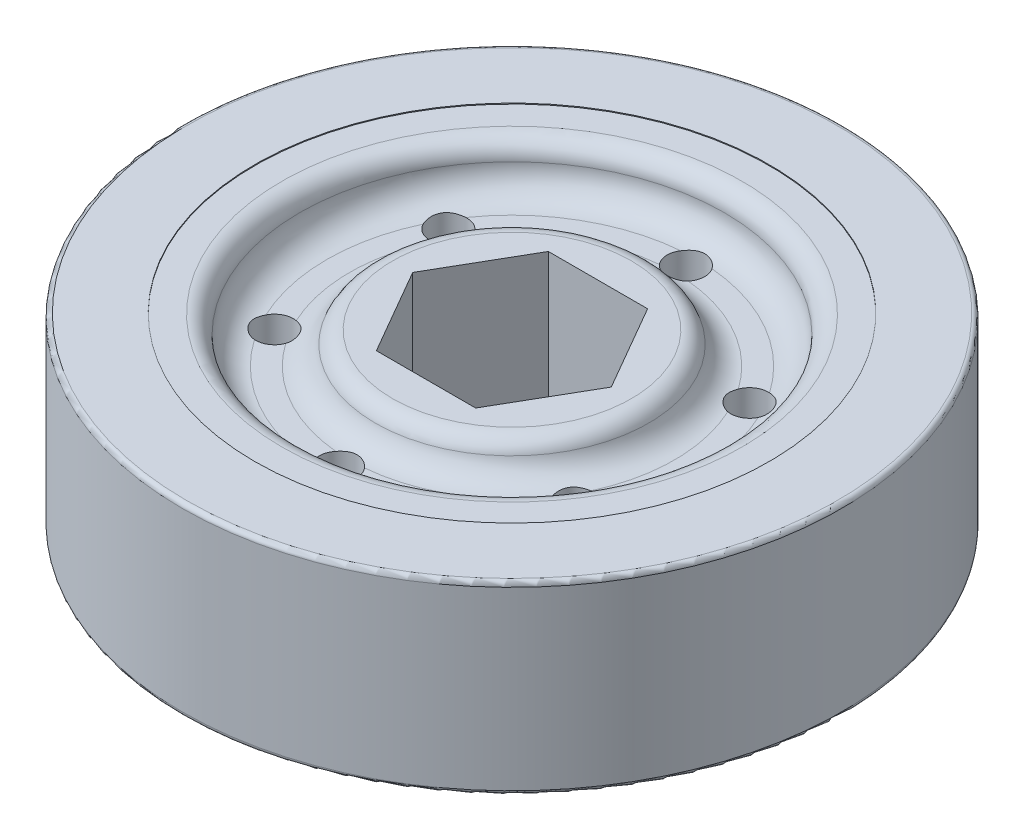
from build123d import *

# Parameters (mm, degrees)
BOSS_EXTRUDE1_DEPTH      = 10.16
BOSS_EXTRUDE1_DEPTH_BACK = 10.16
SKETCH1_R                = 28.5
SKETCH1_R_2              = 23.5
BOSS_EXTRUDE2_DEPTH      = 5.16
BOSS_EXTRUDE2_DEPTH_BACK = 5.16
SKETCH1_3_R              = 23.5
SKETCH1_3_R_2            = 15
BOSS_EXTRUDE3_DEPTH      = 8.66
BOSS_EXTRUDE3_DEPTH_BACK = 8.66
SKETCH1_4_R              = 15
BOSS_EXTRUDE4_DEPTH      = 10.26
BOSS_EXTRUDE4_DEPTH_BACK = 10.26
SKETCH1_5_R              = 36.5125
SKETCH1_5_R_2            = 28.5
FILLET1_R                = 3
FILLET2_R                = 2
FILLET3_R                = 3
FILLET4_R                = 2
FILLET5_R                = 0.5
CUT_EXTRUDE1_DEPTH       = 10.16
CUT_EXTRUDE1_DEPTH_BACK  = 54.889718059
SKETCH2_R                = 2.0828


with BuildPart() as part:
    # Sketch1 → Boss-Extrude1 (new, two sides: drawn at the far end of the back side and taken through both)
    with BuildSketch(Plane(origin=(0, 0, 0), x_dir=(1, 0, 0), z_dir=(0, 1, 0)).offset(-BOSS_EXTRUDE1_DEPTH_BACK)):
        with Locations(Location((0, 0, 0), (0, 0, 270))):
            Circle(SKETCH1_R)
        with Locations(Location((0, 0, 0), (0, 0, 270))):
            Circle(SKETCH1_R_2, mode=Mode.SUBTRACT)
    extrude(amount=BOSS_EXTRUDE1_DEPTH + BOSS_EXTRUDE1_DEPTH_BACK)

    # Sketch1<3> → Boss-Extrude2 (add, two sides: drawn at the far end of the back side and taken through both)
    with BuildSketch(Plane(origin=(0, 0, 0), x_dir=(1, 0, 0), z_dir=(0, 1, 0)).offset(-BOSS_EXTRUDE2_DEPTH_BACK)):
        with Locations(Location((0, 0, 0), (0, 0, 270))):
            Circle(SKETCH1_3_R)
        with Locations(Location((0, 0, 0), (0, 0, 270))):
            Circle(SKETCH1_3_R_2, mode=Mode.SUBTRACT)
    extrude(amount=BOSS_EXTRUDE2_DEPTH + BOSS_EXTRUDE2_DEPTH_BACK)

    # Sketch1<4> → Boss-Extrude3 (add, two sides: drawn at the far end of the back side and taken through both)
    with BuildSketch(Plane(origin=(0, 0, 0), x_dir=(1, 0, 0), z_dir=(0, 1, 0)).offset(-BOSS_EXTRUDE3_DEPTH_BACK)):
        with Locations(Location((0, 0, 0), (0, 0, 270))):
            Circle(SKETCH1_4_R)
        Polygon((5.499261314, -9.525), (10.998522628, 0), (5.499261314, 9.525), (-5.499261314, 9.525), (-10.998522628, 0), (-5.499261314, -9.525), align=None, mode=Mode.SUBTRACT)
    extrude(amount=BOSS_EXTRUDE3_DEPTH + BOSS_EXTRUDE3_DEPTH_BACK)

    # Sketch1<5> → Boss-Extrude4 (add, two sides: drawn at the far end of the back side and taken through both)
    with BuildSketch(Plane(origin=(0, 0, 0), x_dir=(1, 0, 0), z_dir=(0, 1, 0)).offset(-BOSS_EXTRUDE4_DEPTH_BACK)):
        with Locations(Location((0, 0, 0), (0, 0, 270))):
            Circle(SKETCH1_5_R)
        with Locations(Location((0, 0, 0), (0, 0, 270))):
            Circle(SKETCH1_5_R_2, mode=Mode.SUBTRACT)
    extrude(amount=BOSS_EXTRUDE4_DEPTH + BOSS_EXTRUDE4_DEPTH_BACK)

    # Fillet1
    fillet1_edges = [part.edges().sort_by_distance(p)[0] for p in [
        (0, 5.16, -15),
        (0, 5.16, -23.5),
    ]]
    fillet(fillet1_edges, radius=FILLET1_R)

    # Fillet2
    fillet2_edges = [part.edges().sort_by_distance(p)[0] for p in [
        (0, 8.66, -15),
        (0, 10.16, -23.5),
    ]]
    fillet(fillet2_edges, radius=FILLET2_R - 0.0001)  # a hair under: the kernel refuses the full size

    # Fillet3
    fillet3_edges = [part.edges().sort_by_distance(p)[0] for p in [
        (0, -5.16, -23.5),
        (0, -5.16, -15),
    ]]
    fillet(fillet3_edges, radius=FILLET3_R)

    # Fillet4
    fillet4_edges = [part.edges().sort_by_distance(p)[0] for p in [
        (0, -10.16, -23.5),
        (0, -8.66, -15),
    ]]
    fillet(fillet4_edges, radius=FILLET4_R - 0.0001)  # a hair under: the kernel refuses the full size

    # Fillet5
    fillet5_edges = [part.edges().sort_by_distance(p)[0] for p in [
        (0, -10.26, -36.5125),
        (0, 10.26, -36.5125),
    ]]
    fillet(fillet5_edges, radius=FILLET5_R)

    # Sketch2 → Cut-Extrude1 (cut, two sides: drawn at the far end of the back side and taken through both)
    with BuildSketch(Plane(origin=(0, 5.16, 0), x_dir=(1, 0, 0), z_dir=(0, 1, 0)).offset(-CUT_EXTRUDE1_DEPTH_BACK)):
        with Locations(Location((0, 19.268944393, 0), (0, 0, 33.772262726))):
            Circle(SKETCH2_R)
        with Locations(Location((16.687395348, 9.634472196, 0), (0, 0, 86.227737276))):
            Circle(SKETCH2_R)
        with Locations(Location((16.687395348, -9.634472196, 0), (0, 0, 100.033389895))):
            Circle(SKETCH2_R)
        with Locations(Location((0, -19.268944393, 0), (0, 0, 139.966610104))):
            Circle(SKETCH2_R)
        with Locations(Location((-16.687395348, -9.634472196, 0), (0, 0, 79.9666101))):
            Circle(SKETCH2_R)
        with Locations(Location((-16.687395348, 9.634472196, 0), (0, 0, 93.772262726))):
            Circle(SKETCH2_R)
    extrude(amount=CUT_EXTRUDE1_DEPTH + CUT_EXTRUDE1_DEPTH_BACK, mode=Mode.SUBTRACT)


solid = part.part
